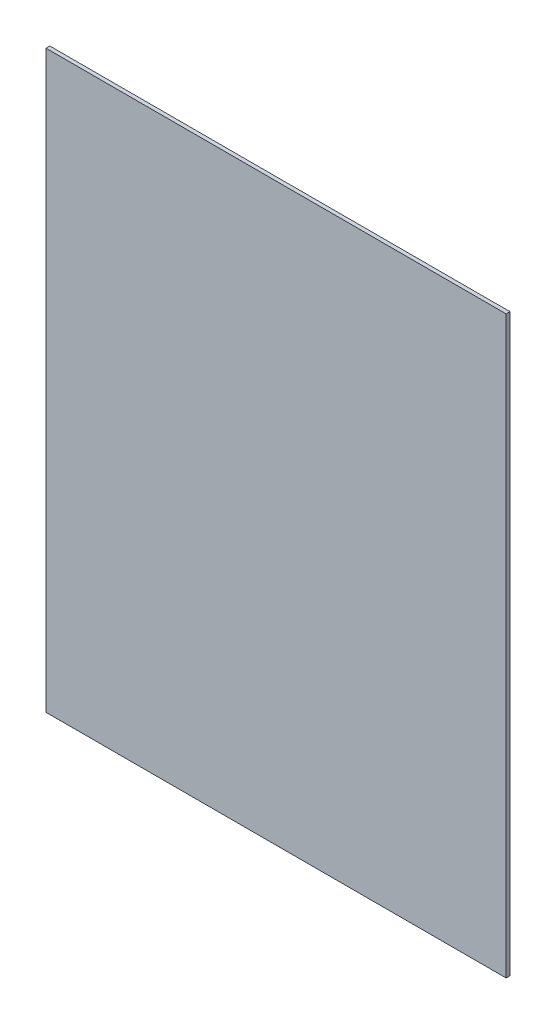
from build123d import *

# Parameters (mm, degrees)
IZIM1_W            = 1200
IZIM1_H            = 1500
TABAN_FLAN_1_DEPTH = 10


# Sheet-metal steps are written as plain solids
with BuildPart() as part:
    # Çizim1 → Taban-Flanş1 (new body)
    with BuildSketch(Plane.XY):
        with Locations((600, -750)):
            Rectangle(IZIM1_W, IZIM1_H)
    extrude(amount=-TABAN_FLAN_1_DEPTH)


solid = part.part
